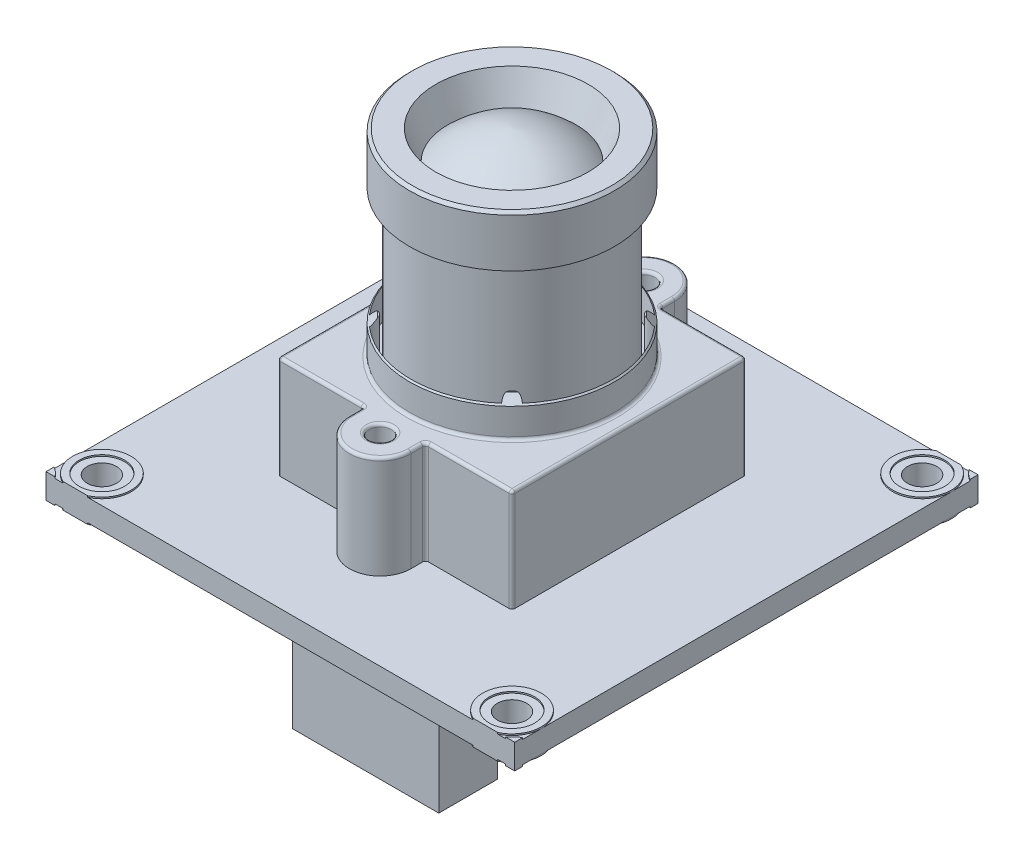
from build123d import *

# Parameters (mm, degrees)
SKETCH1_R                      = 1
PCB_DEPTH                      = 1.5
SKETCH2_R                      = 0.75
LENS_MOUNT_DEPTH               = 7
BOSS_EXTRUDE3_OUTLINE_R        = 7
BOSS_EXTRUDE3_DEPTH            = 2.5
CHAMFER1_SIZE                  = 0.5
MOUNTING_HOLES_DEPTH           = 0.1
MOUNTING_HOLES_DEPTH_BACK      = 1.6
SKETCH4_R                      = 2
SKETCH4_R_2                    = 1.55
SKETCH5_R                      = 6.25
LENS_THREAD_DEPTH              = 10
SKETCH6_R                      = 7
LENS_GLASS_SURROUND_DEPTH      = 3.5
CHAMFER2_SIZE                  = 0.2
SKETCH7_R                      = 5.2
LENS_RECESS_DEPTH              = 2
CHAMFER3_SIZE2                 = 0.808052452
CHAMFER3_SIZE                  = 2
SKETCH10_R                     = 4.391947548
LENS_CAVITY_DEPTH              = 10
CHAMFER4_SIZE                  = 9
CHAMFER4_SIZE2                 = 1.913009055
SKETCH11_W                     = 10
SKETCH11_H                     = 4
BOSS_EXTRUDE4_DEPTH            = 6
SKETCH12_W                     = 9
SKETCH12_H                     = 3
SKETCH12_W_2                   = 2
SKETCH12_H_2                   = 0.5
CUT_EXTRUDE1_DEPTH             = 5.5
SKETCH13_W                     = 1
SKETCH13_H                     = 1
BOSS_EXTRUDE5_DEPTH            = 5.5
BOSS_EXTRUDE5_2_DEPTH          = 5.5
BOSS_EXTRUDE5_3_DEPTH          = 5.5
BOSS_EXTRUDE5_4_DEPTH          = 5.5
CHAMFER5_SIZE                  = 0.4
CHAMFER6_SIZE                  = 0.4
CHAMFER7_SIZE                  = 0.4
CHAMFER8_SIZE                  = 0.4
FILLET1_R                      = 0.2
CUT_EXTRUDE2_DEPTH             = 35.727510772
CUT_EXTRUDE2_DEPTH_BACK        = 35.727510772
SKETCH14_W                     = 10
SKETCH14_H                     = 1
SKETCH14_W_2                   = 1
SKETCH14_H_2                   = 10
CUT_EXTERIOR_OF_PCB_DEPTH      = 35.727510772
CUT_EXTERIOR_OF_PCB_DEPTH_BACK = 35.727510772
SKETCH18_W                     = 38
SKETCH18_H                     = 38
SKETCH18_W_2                   = 32
SKETCH18_H_2                   = 31.631456144


# Read off the part's stored shape, not the designer's step: Boss-Extrude3
# Some blends are built 0.0001 mm under size
with BuildPart() as part:
    # Sketch1 → PCB (new body)
    with BuildSketch(Plane(origin=(0, 0, 0), x_dir=(1, 0, 0), z_dir=(0, 1, 0))):
        with BuildLine():
            Line((-18, -19), (18, -19))
            ThreePointArc((18, -19), (18.707106781, -18.707106781), (19, -18))
            Line((19, -18), (19, 18))
            ThreePointArc((19, 18), (18.707106781, 18.707106781), (18, 19))
            Line((18, 19), (-18, 19))
            ThreePointArc((-18, 19), (-18.707106781, 18.707106781), (-19, 18))
            Line((-19, 18), (-19, -18))
            ThreePointArc((-19, -18), (-18.707106781, -18.707106781), (-18, -19))
        make_face()
        with Locations(Location((-17, -17, 0), (0, 0, 270))):
            Circle(SKETCH1_R, mode=Mode.SUBTRACT)
        with Locations(Location((17, -17, 0), (0, 0, 270))):
            Circle(SKETCH1_R, mode=Mode.SUBTRACT)
        with Locations(Location((17, 17, 0), (0, 0, 270))):
            Circle(SKETCH1_R, mode=Mode.SUBTRACT)
        with Locations(Location((-17, 17, 0), (0, 0, 270))):
            Circle(SKETCH1_R, mode=Mode.SUBTRACT)
        with Locations(Location((-14, 14, 0), (0, 0, 270))):
            Circle(SKETCH1_R, mode=Mode.SUBTRACT)
        with Locations(Location((14, -14, 0), (0, 0, 270))):
            Circle(SKETCH1_R, mode=Mode.SUBTRACT)
        with Locations(Location((14, 14, 0), (0, 0, 270))):
            Circle(SKETCH1_R, mode=Mode.SUBTRACT)
        with Locations(Location((-14, -14, 0), (0, 0, 270))):
            Circle(SKETCH1_R, mode=Mode.SUBTRACT)
    extrude(amount=PCB_DEPTH)

    # Sketch2 → Lens Mount (add)
    with BuildSketch(Plane(origin=(0, 1.5, 0), x_dir=(1, 0, 0), z_dir=(0, 1, 0))):
        with BuildLine():
            Line((-8, 8), (-8, -8))
            Line((-8, -8), (-2.1, -8))
            Line((-2.1, -8), (-2.1, -9))
            ThreePointArc((-2.1, -9), (0, -11.1), (2.1, -9))
            Line((2.1, -9), (2.1, -8))
            Line((2.1, -8), (8, -8))
            Line((8, -8), (8, 8))
            Line((8, 8), (2.1, 8))
            Line((2.1, 8), (2.1, 9))
            ThreePointArc((2.1, 9), (0, 11.1), (-2.1, 9))
            Line((-2.1, 9), (-2.1, 8))
            Line((-2.1, 8), (-8, 8))
        make_face()
        with Locations(Location((0, 9, 0), (0, 0, 270))):
            Circle(SKETCH2_R, mode=Mode.SUBTRACT)
        with Locations(Location((0, -9, 0), (0, 0, 270))):
            Circle(SKETCH2_R, mode=Mode.SUBTRACT)
    extrude(amount=LENS_MOUNT_DEPTH)

    # Boss-Extrude3 outline → Boss-Extrude3 (add)
    with BuildSketch(Plane(origin=(0, 8.5, 0), x_dir=(1, 0, 0), z_dir=(0, 1, 0))):
        Circle(BOSS_EXTRUDE3_OUTLINE_R)
        with BuildLine():
            ThreePointArc((-4.512905634, -5.219548136), (-4.5254834, -4.5254834), (-5.219548136, -4.512905634))
            ThreePointArc((-5.219548136, -4.512905634), (-6.9, 0), (-5.219548136, 4.512905634))
            ThreePointArc((-5.219548136, 4.512905634), (-4.5254834, 4.5254834), (-4.512905634, 5.219548136))
            ThreePointArc((-4.512905634, 5.219548136), (0, 6.9), (4.512905634, 5.219548136))
            ThreePointArc((4.512905634, 5.219548136), (4.5254834, 4.5254834), (5.219548136, 4.512905634))
            ThreePointArc((5.219548136, 4.512905634), (6.9, 0), (5.219548136, -4.512905634))
            ThreePointArc((5.219548136, -4.512905634), (4.5254834, -4.5254834), (4.512905634, -5.219548136))
            ThreePointArc((4.512905634, -5.219548136), (0, -6.9), (-4.512905634, -5.219548136))
        make_face(mode=Mode.SUBTRACT)
    extrude(amount=BOSS_EXTRUDE3_DEPTH)

    # Chamfer1
    # the kernel refuses this chamfer: 0.5 mm, written as the material it takes off along each edge
    with BuildSketch(Plane(origin=(0, 11, 0), x_dir=(1, 0, 0), z_dir=(0, 0, 1))) as chamfer1_piece_1:
        Polygon((7, -CHAMFER1_SIZE), (7 - CHAMFER1_SIZE, 0), (7, 0), align=None)
    revolve(axis=Axis((0, 11, 0), (0, 1, 0)), mode=Mode.SUBTRACT)

    # Sketch4 → Mounting Holes (add, two sides: drawn at the far end of the back side and taken through both)
    # profile 1 of 8: a face of its own
    with BuildSketch(Plane(origin=(0, 1.5, 0), x_dir=(1, 0, 0), z_dir=(0, 1, 0)).offset(-MOUNTING_HOLES_DEPTH_BACK)):
        with Locations(Location((17, -17, 0), (0, 0, 270))):
            Circle(SKETCH4_R)
        with Locations(Location((17, -17, 0), (0, 0, 90))):
            Circle(SKETCH4_R_2, mode=Mode.SUBTRACT)
    # profile 2 of 8: a face of its own
    with BuildSketch(Plane(origin=(0, 1.5, 0), x_dir=(1, 0, 0), z_dir=(0, 1, 0)).offset(-MOUNTING_HOLES_DEPTH_BACK)):
        with Locations(Location((-17, -17, 0), (0, 0, 270))):
            Circle(SKETCH4_R)
        with Locations(Location((-17, -17, 0), (0, 0, 90))):
            Circle(SKETCH4_R_2, mode=Mode.SUBTRACT)
    # profile 3 of 8: a face of its own
    with BuildSketch(Plane(origin=(0, 1.5, 0), x_dir=(1, 0, 0), z_dir=(0, 1, 0)).offset(-MOUNTING_HOLES_DEPTH_BACK)):
        with Locations(Location((-17, 17, 0), (0, 0, 90))):
            Circle(SKETCH4_R)
        with Locations(Location((-17, 17, 0), (0, 0, 90))):
            Circle(SKETCH4_R_2, mode=Mode.SUBTRACT)
    # profile 4 of 8: a face of its own
    with BuildSketch(Plane(origin=(0, 1.5, 0), x_dir=(1, 0, 0), z_dir=(0, 1, 0)).offset(-MOUNTING_HOLES_DEPTH_BACK)):
        with Locations(Location((17, 17, 0), (0, 0, 90))):
            Circle(SKETCH4_R)
        with Locations(Location((17, 17, 0), (0, 0, 90))):
            Circle(SKETCH4_R_2, mode=Mode.SUBTRACT)
    # profile 5 of 8: a face of its own
    with BuildSketch(Plane(origin=(0, 1.5, 0), x_dir=(1, 0, 0), z_dir=(0, 1, 0)).offset(-MOUNTING_HOLES_DEPTH_BACK)):
        with Locations(Location((14, -14, 0), (0, 0, 90))):
            Circle(SKETCH4_R)
        with Locations(Location((14, -14, 0), (0, 0, 90))):
            Circle(SKETCH4_R_2, mode=Mode.SUBTRACT)
    # profile 6 of 8: a face of its own
    with BuildSketch(Plane(origin=(0, 1.5, 0), x_dir=(1, 0, 0), z_dir=(0, 1, 0)).offset(-MOUNTING_HOLES_DEPTH_BACK)):
        with Locations(Location((-14, -14, 0), (0, 0, 90))):
            Circle(SKETCH4_R)
        with Locations(Location((-14, -14, 0), (0, 0, 90))):
            Circle(SKETCH4_R_2, mode=Mode.SUBTRACT)
    # profile 7 of 8: a face of its own
    with BuildSketch(Plane(origin=(0, 1.5, 0), x_dir=(1, 0, 0), z_dir=(0, 1, 0)).offset(-MOUNTING_HOLES_DEPTH_BACK)):
        with Locations(Location((-14, 14, 0), (0, 0, 90))):
            Circle(SKETCH4_R)
        with Locations(Location((-14, 14, 0), (0, 0, 90))):
            Circle(SKETCH4_R_2, mode=Mode.SUBTRACT)
    # profile 8 of 8: a face of its own
    with BuildSketch(Plane(origin=(0, 1.5, 0), x_dir=(1, 0, 0), z_dir=(0, 1, 0)).offset(-MOUNTING_HOLES_DEPTH_BACK)):
        with Locations(Location((14, 14, 0), (0, 0, 90))):
            Circle(SKETCH4_R)
        with Locations(Location((14, 14, 0), (0, 0, 90))):
            Circle(SKETCH4_R_2, mode=Mode.SUBTRACT)
    extrude(amount=MOUNTING_HOLES_DEPTH + MOUNTING_HOLES_DEPTH_BACK)

    # Sketch5 → Lens Thread (add)
    with BuildSketch(Plane(origin=(0, 8.5, 0), x_dir=(1, 0, 0), z_dir=(0, 1, 0))):
        with Locations(Location((0, 0, 0), (0, 0, 90))):
            Circle(SKETCH5_R)
    extrude(amount=LENS_THREAD_DEPTH)

    # Sketch6 → Lens Glass Surround (add)
    with BuildSketch(Plane(origin=(0, 18.5, 0), x_dir=(1, 0, 0), z_dir=(0, 1, 0))):
        with Locations(Location((0, 0, 0), (0, 0, 90))):
            Circle(SKETCH6_R)
    extrude(amount=LENS_GLASS_SURROUND_DEPTH)

    # Chamfer2
    chamfer2_edges = [part.edges().sort_by_distance(p)[0] for p in [
        (0, 22, 7),
    ]]
    chamfer(chamfer2_edges, length=CHAMFER2_SIZE)

    # Sketch7 → Lens Recess (cut)
    with BuildSketch(Plane(origin=(0, 22, 0), x_dir=(1, 0, 0), z_dir=(0, 1, 0))):
        with Locations(Location((0, 0, 0), (0, 0, 270))):
            Circle(SKETCH7_R)
    extrude(amount=-LENS_RECESS_DEPTH, mode=Mode.SUBTRACT)

    # Chamfer3
    chamfer3_edges = [part.edges().sort_by_distance(p)[0] for p in [
        (0, 20, -5.2),
    ]]
    chamfer3_side = [part.faces().sort_by_distance(p)[0] for p in [
        (0, 20.016161049, -5.2),
    ]]
    chamfer(chamfer3_edges, length=CHAMFER3_SIZE - 0.0001, length2=CHAMFER3_SIZE2 - 0.0001, reference=chamfer3_side[0])  # a hair under: the kernel refuses the full size

    # Sketch9 → Glass Lens (revolve)
    with BuildSketch(Plane(origin=(0, 0, 0), x_dir=(0.9889956423843607, -6.796666946599717e-12, -0.14794464959823986), z_dir=(0.14794464959823986, -3.2080034615912436e-12, 0.9889956423843607)), mode=Mode.PRIVATE) as glass_lens_sk:
        with BuildLine():
            Line((0, 20), (-4.391946884, 20))
            ThreePointArc((-4.391946884, 20), (-2.365284698, 21.371803022), (0, 22))
            Line((0, 22), (0, 20))
        make_face()
    revolve(glass_lens_sk.sketch.rotate(Axis((0, 20, 0), (7.1963598239252005e-12, 1.0, 2.1671890524112097e-12)), 261.492165269), axis=Axis((0, 20, 0), (7.1963598239252005e-12, 1.0, 2.1671890524112097e-12)))

    # Sketch10 → Lens Cavity (cut)
    with BuildSketch(Plane(origin=(0, 20, 0), x_dir=(1, 0, 0), z_dir=(0, 1, 0))):
        with Locations(Location((0, 0, 0), (0, 0, 270))):
            Circle(SKETCH10_R)
    extrude(amount=-LENS_CAVITY_DEPTH, mode=Mode.SUBTRACT)


with BuildPart() as lens_cavity_piece_1:
    # of the separate pieces the step leaves, piece 1, a body of its own (lens_cavity_pieces)
    add(part.part.solids().sort_by_distance((0, 21.9999, 5.2))[0])

    # Chamfer4
    chamfer4_edges = [lens_cavity_piece_1.edges().sort_by_distance(p)[0] for p in [
        (0, 10, -4.391947548),
    ]]
    chamfer4_side = [lens_cavity_piece_1.faces().sort_by_distance(p)[0] for p in [
        (0, 15, -4.391947548),
    ]]
    chamfer(chamfer4_edges, length=CHAMFER4_SIZE, length2=CHAMFER4_SIZE2, reference=chamfer4_side[0])

    # Fillet1
    fillet1_edges = [lens_cavity_piece_1.edges().sort_by_distance(p)[0] for p in [
        (8, 5, 8),
        (8, 5, -8),
        (2.1, 5, -8),
        (0, 8.5, -9.75),
        (0, 8.5, 8.25),
        (-7, 8.5, 0),
        (-5.05, 8.5, -8),
        (-8, 8.5, 0),
        (-5.05, 8.5, 8),
        (-2.1, 8.5, 8.5),
        (0, 8.5, 11.1),
        (2.1, 8.5, 8.5),
        (5.05, 8.5, 8),
        (8, 8.5, 0),
        (5.05, 8.5, -8),
        (2.1, 8.5, -8.5),
        (0, 8.5, -11.1),
        (-2.1, 8.5, -8.5),
        (-2.1, 5, -8),
        (-8, 5, -8),
        (-8, 5, 8),
        (-2.1, 5, 8),
        (2.1, 5, 8),
    ]]
    fillet(fillet1_edges, radius=FILLET1_R)

    # Sketch14 → Cut-Extrude2 (cut, two sides: drawn at the far end of the back side and taken through both)
    with BuildSketch(Plane(origin=(0, 0, 0), x_dir=(1, 0, 0), z_dir=(0, 1, 0)).offset(-CUT_EXTRUDE2_DEPTH_BACK)):
        Polygon((-17, 8), (-16, 8), (-16, 16), (-17, 17), align=None)
        Polygon((-17, 17), (-16, 16), (-8, 16), (-8, 17), align=None)
        with Locations((0, 16.5)):
            Rectangle(SKETCH14_W, SKETCH14_H)
        with Locations((-16.5, 0)):
            Rectangle(SKETCH14_W_2, SKETCH14_H_2)
        Polygon((-8, -16), (-16, -16), (-16, -8), (-17, -8), (-17, -17), (-8, -17), align=None)
        with Locations((0, -16.5)):
            Rectangle(SKETCH14_W, SKETCH14_H)
        Polygon((16, -8), (16, -16), (17, -17), (17, -8), align=None)
        with Locations((16.5, 0)):
            Rectangle(SKETCH14_W_2, SKETCH14_H_2)
        Polygon((16, -16), (8, -16), (8, -17), (17, -17), align=None)
        Polygon((16, 16), (16, 8), (17, 8), (17, 17), (8, 17), (8, 16), align=None)
    extrude(amount=CUT_EXTRUDE2_DEPTH + CUT_EXTRUDE2_DEPTH_BACK, mode=Mode.SUBTRACT)

    # Sketch18 → Cut Exterior of PCB (cut, two sides: drawn at the far end of the back side and taken through both)
    with BuildSketch(Plane.XZ.offset(-CUT_EXTERIOR_OF_PCB_DEPTH_BACK)):
        Rectangle(SKETCH18_W, SKETCH18_H)
        Rectangle(SKETCH18_W_2, SKETCH18_H_2, mode=Mode.SUBTRACT)
    extrude(amount=CUT_EXTERIOR_OF_PCB_DEPTH + CUT_EXTERIOR_OF_PCB_DEPTH_BACK, mode=Mode.SUBTRACT)


with BuildPart() as lens_cavity_piece_2:
    # of the separate pieces the step leaves, piece 2, a body of its own (lens_cavity_pieces)
    add(part.part.solids().sort_by_distance((0, 22, 0))[0])


with BuildPart() as body_3:
    # Sketch11 → Boss-Extrude4 (new body)
    with BuildSketch(Plane.XZ):
        with Locations((5, 13)):
            Rectangle(SKETCH11_W, SKETCH11_H)
    extrude(amount=BOSS_EXTRUDE4_DEPTH)

    # Sketch12 → Cut-Extrude1 (cut)
    with BuildSketch(Plane.XZ.offset(6)):
        with Locations((5, 13)):
            Rectangle(SKETCH12_W, SKETCH12_H)
        with Locations((5, 11.25)):
            Rectangle(SKETCH12_W_2, SKETCH12_H_2)
    extrude(amount=-CUT_EXTRUDE1_DEPTH, mode=Mode.SUBTRACT)


with BuildPart() as body_4:
    # Sketch13 → Boss-Extrude5 (new body)
    with BuildSketch(Plane.XZ.offset(0.5)):
        with Locations((1.19, 13.5)):
            Rectangle(SKETCH13_W, SKETCH13_H)
    extrude(amount=BOSS_EXTRUDE5_DEPTH)

    # Chamfer8
    chamfer8_edges = [body_4.edges().sort_by_distance(p)[0] for p in [
        (1.19, -6, 13),
        (1.69, -6, 13.5),
        (1.19, -6, 14),
        (0.69, -6, 13.5),
    ]]
    chamfer(chamfer8_edges, length=CHAMFER8_SIZE)


with BuildPart() as body_5:
    # Sketch13 → Boss-Extrude5 2 (new body)
    with BuildSketch(Plane.XZ.offset(0.5)):
        with Locations((3.73, 13.5)):
            Rectangle(SKETCH13_W, SKETCH13_H)
    extrude(amount=BOSS_EXTRUDE5_2_DEPTH)

    # Chamfer7
    chamfer7_edges = [body_5.edges().sort_by_distance(p)[0] for p in [
        (3.73, -6, 13),
        (4.23, -6, 13.5),
        (3.73, -6, 14),
        (3.23, -6, 13.5),
    ]]
    chamfer(chamfer7_edges, length=CHAMFER7_SIZE)


with BuildPart() as body_6:
    # Sketch13 → Boss-Extrude5 3 (new body)
    with BuildSketch(Plane.XZ.offset(0.5)):
        with Locations((6.27, 13.5)):
            Rectangle(SKETCH13_W, SKETCH13_H)
    extrude(amount=BOSS_EXTRUDE5_3_DEPTH)

    # Chamfer5
    chamfer5_edges = [body_6.edges().sort_by_distance(p)[0] for p in [
        (6.27, -6, 13),
        (6.77, -6, 13.5),
        (6.27, -6, 14),
        (5.77, -6, 13.5),
    ]]
    chamfer(chamfer5_edges, length=CHAMFER5_SIZE)


with BuildPart() as body_7:
    # Sketch13 → Boss-Extrude5 4 (new body)
    with BuildSketch(Plane.XZ.offset(0.5)):
        with Locations((8.81, 13.5)):
            Rectangle(SKETCH13_W, SKETCH13_H)
    extrude(amount=BOSS_EXTRUDE5_4_DEPTH)

    # Chamfer6
    chamfer6_edges = [body_7.edges().sort_by_distance(p)[0] for p in [
        (8.81, -6, 13),
        (9.31, -6, 13.5),
        (8.81, -6, 14),
        (8.31, -6, 13.5),
    ]]
    chamfer(chamfer6_edges, length=CHAMFER6_SIZE)


solid = Compound([lens_cavity_piece_1.part, lens_cavity_piece_2.part, body_3.part, body_4.part, body_5.part, body_6.part, body_7.part])
